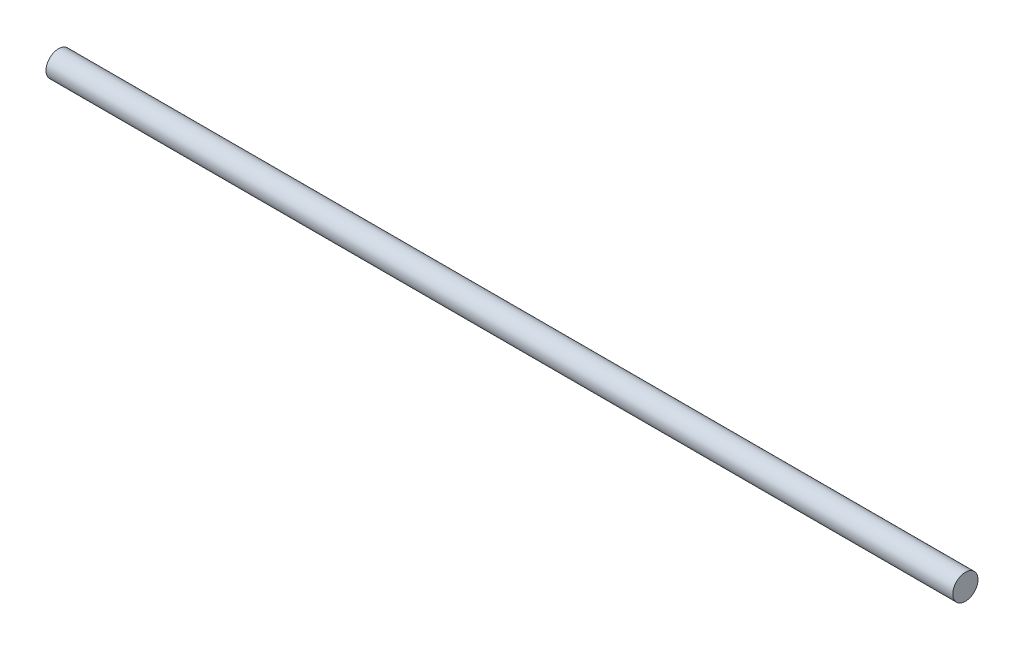
from build123d import *

# Parameters (mm, degrees)
SKETCH1_R           = 6.35
BOSS_EXTRUDE1_DEPTH = 457.2


with BuildPart() as part:
    # Sketch1 → Boss-Extrude1 (new body)
    with BuildSketch(Plane(origin=(0, 0, 0), x_dir=(0, 0, -1), z_dir=(1, 0, 0))):
        Circle(SKETCH1_R)
    extrude(amount=BOSS_EXTRUDE1_DEPTH)


solid = part.part
